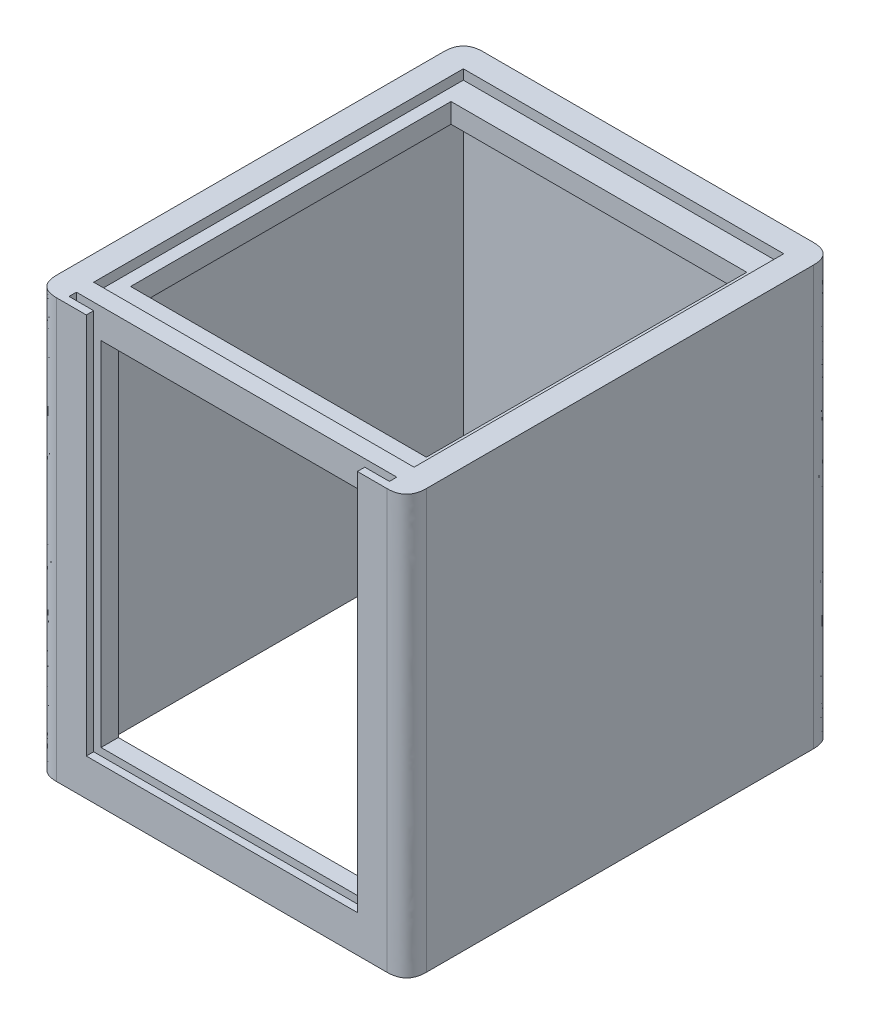
from build123d import *

# Parameters (mm, degrees)
SKETCH_2_W                  = 150
SKETCH_2_H                  = 170
EXTRUDE_2_DEPTH             = 170
SHELL_5_T                   = -4
SKETCH_3_W                  = 130
SKETCH_3_H                  = 150
CUT_EXTRUDE_1_DEPTH         = 205.328167417
SKETCH_4_W                  = 150
SKETCH_4_H                  = 170
SKETCH_4_W_2                = 120
SKETCH_4_H_2                = 130
EXTRUDE_3_DEPTH             = 8
EXTRUDE_4_REACH             = 253.843
EXTRUDE_4_DIRECTION_2_DEPTH = 3
SKETCH_6_W                  = 130
SKETCH_6_H                  = 3
CUT_EXTRUDE_2_DEPTH         = 165
FILLET_1_SIZE               = 8


with BuildPart() as part:
    # 草圖2 → 填料-伸長2 (new body)
    with BuildSketch(Plane(origin=(0, 0, 0), x_dir=(1, 0, 0), z_dir=(0, 1, 0))):
        Rectangle(SKETCH_2_W, SKETCH_2_H)
    extrude(amount=EXTRUDE_2_DEPTH)

    # 薄殼5
    shell_5_openings = [part.faces().sort_by_distance(p)[0] for p in [
        (0, 0, 0),
        (0, 85, 85),
    ]]
    offset(amount=SHELL_5_T, openings=shell_5_openings, kind=Kind.INTERSECTION)

    # 草圖3 → 除料-伸長1 (cut, through all)
    with BuildSketch(Plane(origin=(0, 170, 0), x_dir=(1, 0, 0), z_dir=(0, 1, 0))):
        Rectangle(SKETCH_3_W, SKETCH_3_H)
    extrude(amount=-CUT_EXTRUDE_1_DEPTH, mode=Mode.SUBTRACT)

    # 草圖4 → 填料-伸長3 (add)
    with BuildSketch(Plane.XZ.offset(-166)):
        Rectangle(SKETCH_4_W, SKETCH_4_H)
        Rectangle(SKETCH_4_W_2, SKETCH_4_H_2, mode=Mode.SUBTRACT)
    extrude(amount=EXTRUDE_3_DEPTH)

    # 填料-伸長4: up to this face of the body (flat: up to its plane)
    extrude_4_end = Plane(part.part.faces().sort_by_distance((0, 168, 75))[0])
    # 草圖5 → 填料-伸長4 (add, up to the picked face)
    with BuildSketch(Plane.XY.offset(85), mode=Mode.PRIVATE) as extrude_4_sk1:
        Polygon((55, 170), (75, 170), (75, 0), (-75, 0), (-75, 170), (-55, 170), (-55, 15), (55, 15), align=None)
    extrude_4_tool1 = split(extrude(extrude_4_sk1.sketch, amount=-EXTRUDE_4_REACH, mode=Mode.PRIVATE), bisect_by=extrude_4_end, keep=Keep.BOTH, mode=Mode.PRIVATE)
    add(extrude_4_tool1.solids().sort_by(Axis((65, 167.732843, 85), (0, 0, -1)))[0])

    # 草圖5 → 填料-伸長4 direction 2 (add)
    with BuildSketch(Plane.XY.offset(85)):
        Polygon((55, 170), (75, 170), (75, 0), (-75, 0), (-75, 170), (-55, 170), (-55, 15), (55, 15), align=None)
    extrude(amount=EXTRUDE_4_DIRECTION_2_DEPTH)

    # 草圖6 → 除料-伸長2 (cut)
    with BuildSketch(Plane(origin=(0, 170, 0), x_dir=(1, 0, 0), z_dir=(0, 1, 0))):
        with Locations((0, -83.5)):
            Rectangle(SKETCH_6_W, SKETCH_6_H)
    extrude(amount=-CUT_EXTRUDE_2_DEPTH, mode=Mode.SUBTRACT)

    # 圓角1
    # a fillet whose section is not a circle: 8 mm, written as the material it takes off along each edge
    with BuildSketch(Plane(origin=(75, -20, -85), x_dir=(0, 0, 1), z_dir=(0, 1, 0)), Plane(origin=(-75, -20, -85), x_dir=(1, 0, 0), z_dir=(0, 1, 0)), Plane(origin=(75, 190, 88), x_dir=(0, 0, -1), z_dir=(0, -1, 0)), Plane(origin=(-75, -20, 88), x_dir=(0, 0, -1), z_dir=(0, 1, 0))) as fillet_1_piece_1:
        with BuildLine():
            Bezier((FILLET_1_SIZE, 0), (0, 0), (0, -FILLET_1_SIZE), weights=[1, 1, 1])
            Line((0, -FILLET_1_SIZE), (0, 0))
            Line((0, 0), (FILLET_1_SIZE, 0))
        make_face()
    extrude(amount=210, mode=Mode.SUBTRACT)


solid = part.part
